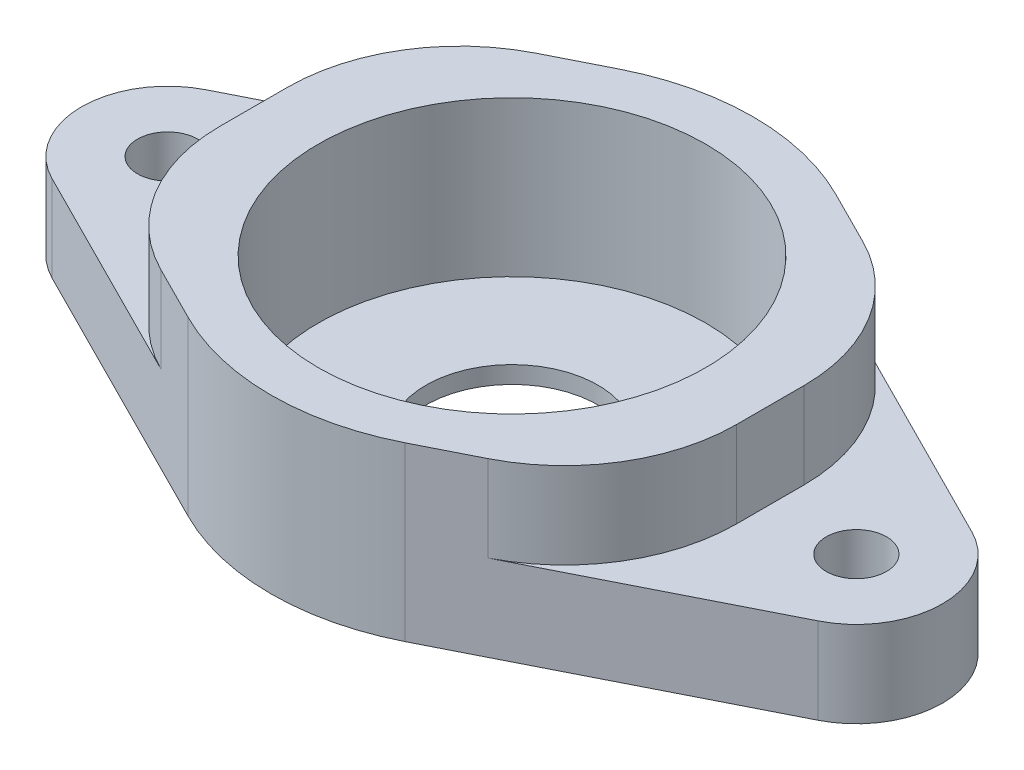
from build123d import *

# Parameters (mm, degrees)
SKETCH2_R               = 1.75
BOSS_EXTRUDE1_DEPTH     = 10
SKETCH3_R               = 11.25
CUT_EXTRUDE1_DEPTH      = 9
CUT_EXTRUDE2_DEPTH      = 31.347981811
CUT_EXTRUDE2_DEPTH_BACK = 31.347981811
SKETCH4_W               = 10
SKETCH4_H               = 5
FILLET1_R               = 10
CUT_EXTRUDE3_DEPTH      = 31.033314835
CUT_EXTRUDE3_DEPTH_BACK = 31.033314835
SKETCH5_R               = 5


with BuildPart() as part:
    # Sketch2 → Boss-Extrude1 (new body)
    with BuildSketch(Plane(origin=(0, 0, 0), x_dir=(1, 0, 0), z_dir=(0, 1, 0))):
        with BuildLine():
            Line((-22.25, 4.465142775), (-6.3, 12.50239977))
            ThreePointArc((-6.3, 12.50239977), (0, 14), (6.3, 12.50239977))
            Line((6.3, 12.50239977), (22.25, 4.465142775))
            ThreePointArc((22.25, 4.465142775), (25, 0), (22.25, -4.465142775))
            Line((22.25, -4.465142775), (6.3, -12.50239977))
            ThreePointArc((6.3, -12.50239977), (0, -14), (-6.3, -12.50239977))
            Line((-6.3, -12.50239977), (-22.25, -4.465142775))
            ThreePointArc((-22.25, -4.465142775), (-25, 0), (-22.25, 4.465142775))
        make_face()
        with Locations((-20, 0)):
            Circle(SKETCH2_R, mode=Mode.SUBTRACT)
        with Locations((20, 0)):
            Circle(SKETCH2_R, mode=Mode.SUBTRACT)
    extrude(amount=BOSS_EXTRUDE1_DEPTH)

    # Sketch3 → Cut-Extrude1 (cut)
    with BuildSketch(Plane(origin=(0, 10, 0), x_dir=(1, 0, 0), z_dir=(0, 1, 0))):
        Circle(SKETCH3_R)
    extrude(amount=-CUT_EXTRUDE1_DEPTH, mode=Mode.SUBTRACT)

    # Sketch4 → Cut-Extrude2 (cut, two sides: drawn at the far end of the back side and taken through both)
    with BuildSketch(Plane.XY.offset(-CUT_EXTRUDE2_DEPTH_BACK)):
        with Locations((-20, 7.5)):
            Rectangle(SKETCH4_W, SKETCH4_H)
        with Locations((20, 7.5)):
            Rectangle(SKETCH4_W, SKETCH4_H)
    extrude(amount=CUT_EXTRUDE2_DEPTH + CUT_EXTRUDE2_DEPTH_BACK, mode=Mode.SUBTRACT)

    # Fillet1
    fillet1_edges = [part.edges().sort_by_distance(p)[0] for p in [
        (15, 7.5, 8.118441409),
        (15, 7.5, -8.118441409),
        (-15, 7.5, -8.118441409),
        (-15, 7.5, 8.118441409),
    ]]
    fillet(fillet1_edges, radius=FILLET1_R)

    # Sketch5 → Cut-Extrude3 (cut, two sides: drawn at the far end of the back side and taken through both)
    with BuildSketch(Plane(origin=(0, 1, 0), x_dir=(1, 0, 0), z_dir=(0, 1, 0)).offset(-CUT_EXTRUDE3_DEPTH_BACK)):
        Circle(SKETCH5_R)
    extrude(amount=CUT_EXTRUDE3_DEPTH + CUT_EXTRUDE3_DEPTH_BACK, mode=Mode.SUBTRACT)


solid = part.part
